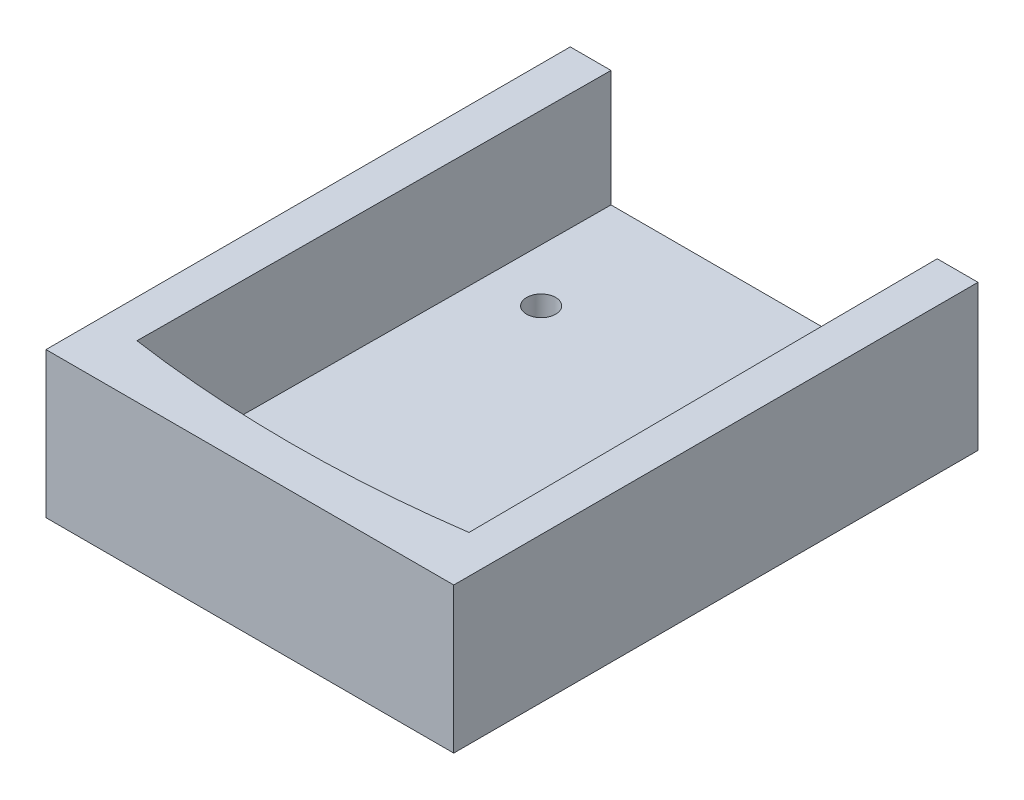
from build123d import *

# Parameters (mm, degrees)
SKETCH1_W           = 70
SKETCH1_H           = 90
BOSS_EXTRUDE1_DEPTH = 25
CUT_EXTRUDE1_DEPTH  = 20
SKETCH7_R           = 2.5
CUT_EXTRUDE6_DEPTH  = 116.758369028


with BuildPart() as part:
    # Sketch1 → Boss-Extrude1 (new body)
    with BuildSketch(Plane(origin=(0, 0, 0), x_dir=(1, 0, 0), z_dir=(0, 1, 0))):
        with Locations((35, 45)):
            Rectangle(SKETCH1_W, SKETCH1_H)
    extrude(amount=BOSS_EXTRUDE1_DEPTH)

    # Sketch2 → Cut-Extrude1 (cut)
    with BuildSketch(Plane(origin=(0, 25, 0), x_dir=(1, 0, 0), z_dir=(0, 1, 0))):
        with BuildLine():
            Line((63, 90), (7, 90))
            Line((7, 90), (6.5, 9.119974633))
            ThreePointArc((6.5, 9.119974633), (35, 7.079353758), (63.5, 9.119974633))
            Line((63.5, 9.119974633), (63, 90))
        make_face()
    extrude(amount=-CUT_EXTRUDE1_DEPTH, mode=Mode.SUBTRACT)

    # Sketch7 → Cut-Extrude6 (cut, through all)
    with BuildSketch(Plane(origin=(0, 5, 0), x_dir=(1, 0, 0), z_dir=(0, 1, 0))):
        with Locations((14, 23)):
            Circle(SKETCH7_R)
        with Locations((16, 69)):
            Circle(SKETCH7_R)
        with Locations((50, 20)):
            Circle(SKETCH7_R)
        with Locations((50.3, 70)):
            Circle(SKETCH7_R)
    extrude(amount=-CUT_EXTRUDE6_DEPTH, mode=Mode.SUBTRACT)


solid = part.part
